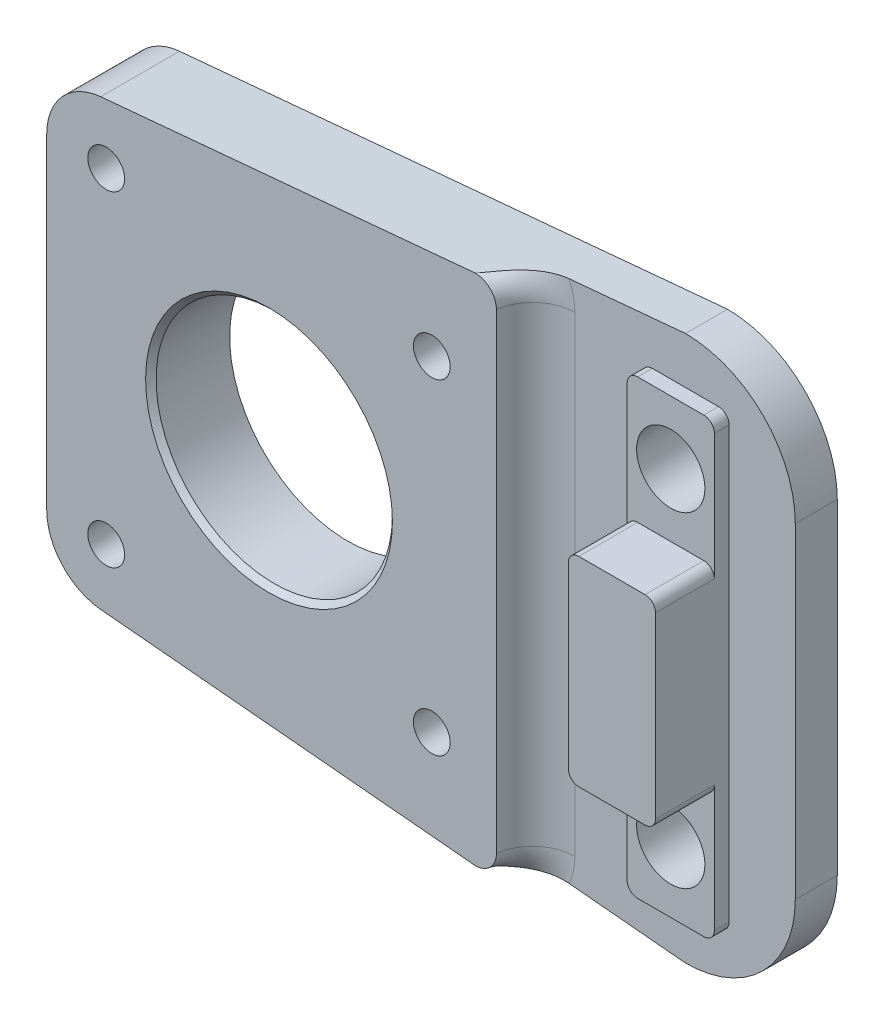
from build123d import *

# Parameters (mm, degrees)
SKETCH_1_R      = 1.7500000000000004
SKETCH_1_R_2    = 1.7499999999999998
SKETCH_1_R_3    = 11.25
SKETCH_1_R_4    = 3.2500000000000004
EXTRUDE_1_DEPTH = 4
SKETCH_1_3_R    = 1.7500000000000004
SKETCH_1_3_R_2  = 1.7499999999999998
SKETCH_1_3_R_3  = 11.25
EXTRUDE_2_DEPTH = 7.5
SKETCH_1_4_W    = 8.299999999999999
SKETCH_1_4_H    = 18.999999999999982
EXTRUDE_3_DEPTH = 11
FILLET_1_R      = 2
FILLET_3_R      = 4
SKETCH_1_5_W    = 8.299999999999999
SKETCH_1_5_H    = 12
SKETCH_1_5_R    = 3.2500000000000004
SKETCH_1_5_H_2  = 11.999999999999996
SKETCH_1_5_H_3  = 18.999999999999982
EXTRUDE_4_DEPTH = 5.4
FILLET_2_R      = 1
CHAMFER_1_SIZE  = 0.5


with BuildPart() as part:
    # Эскиз1 → Бобышка-Вытянуть1 (new body)
    with BuildSketch(Plane.XY):
        with BuildLine():
            ThreePointArc((-32.16450146827534, 21.221984437073093), (-35.82965440560809, 19.39826009426678), (-37.30887383412098, 15.581032511990193))
            Line((-37.30887383412098, 15.581032511990193), (-37.30887383412098, -15.418967488009775))
            ThreePointArc((-37.30887383412098, -15.418967488009775), (-35.829654405608096, -19.23619507028637), (-32.16450146827534, -21.059919413092672))
            Line((-32.16450146827534, -21.059919413092672), (20.006045179765074, -25.87421379899061))
            ThreePointArc((20.006045179765074, -25.87421379899061), (27.399020745235244, -22.811943053479965), (30.46129149074589, -15.41896748800979))
            Line((30.46129149074589, -15.418967488009791), (30.461291490745886, 15.581032511990195))
            ThreePointArc((30.461291490745886, 15.581032511990195), (27.39902074523524, 22.97400807746036), (20.006045179765074, 26.036278822971013))
            Line((20.006045179765074, 26.036278822971013), (-32.16450146827534, 21.221984437073093))
        make_face()
        with Locations((-31.643954820235436, -15.418967488009791)):
            Circle(SKETCH_1_R, mode=Mode.SUBTRACT)
        with Locations((-0.643954820235465, -15.418967488009791)):
            Circle(SKETCH_1_R_2, mode=Mode.SUBTRACT)
        with Locations((-16.14395482023548, 0.08103251199020889)):
            Circle(SKETCH_1_R_3, mode=Mode.SUBTRACT)
        with Locations((-31.643954820235436, 15.581032511990195)):
            Circle(SKETCH_1_R, mode=Mode.SUBTRACT)
        with Locations((-0.643954820235465, 15.581032511990195)):
            Circle(SKETCH_1_R, mode=Mode.SUBTRACT)
        with Locations((20.006045179765074, -15.418967488009791)):
            Circle(SKETCH_1_R_4, mode=Mode.SUBTRACT)
        with Locations((20.00604517976507, 15.581032511990195)):
            Circle(SKETCH_1_R_4, mode=Mode.SUBTRACT)
    extrude(amount=EXTRUDE_1_DEPTH)

    # Эскиз1<3> → Бобышка-Вытянуть2 (add)
    with BuildSketch(Plane.XY):
        with BuildLine():
            ThreePointArc((-32.16450146827534, 21.221984437073093), (-35.82965440560809, 19.39826009426678), (-37.30887383412098, 15.581032511990193))
            Line((-37.30887383412098, 15.581032511990193), (-37.30887383412098, -15.418967488009775))
            ThreePointArc((-37.30887383412098, -15.418967488009775), (-35.829654405608096, -19.23619507028637), (-32.16450146827534, -21.059919413092672))
            Line((-32.16450146827533, -21.059919413092675), (5.506045179765067, -24.536154815893063))
            Line((5.506045179765067, -24.536154815893056), (5.506045179765067, 24.698219839873474))
            Line((5.506045179765069, 24.698219839873467), (-32.16450146827534, 21.221984437073093))
        make_face()
        with Locations((-31.643954820235436, -15.418967488009791)):
            Circle(SKETCH_1_3_R, mode=Mode.SUBTRACT)
        with Locations((-0.643954820235465, -15.418967488009791)):
            Circle(SKETCH_1_3_R_2, mode=Mode.SUBTRACT)
        with Locations((-16.14395482023548, 0.08103251199020889)):
            Circle(SKETCH_1_3_R_3, mode=Mode.SUBTRACT)
        with Locations((-31.643954820235436, 15.581032511990195)):
            Circle(SKETCH_1_3_R, mode=Mode.SUBTRACT)
        with Locations((-0.643954820235465, 15.581032511990195)):
            Circle(SKETCH_1_3_R, mode=Mode.SUBTRACT)
    extrude(amount=EXTRUDE_2_DEPTH)

    # Эскиз1<4> → Бобышка-Вытянуть3 (add)
    with BuildSketch(Plane.XY):
        with Locations((20.00604517976507, 0.08103251199020356)):
            Rectangle(SKETCH_1_4_W, SKETCH_1_4_H)
    extrude(amount=EXTRUDE_3_DEPTH)

    # Скругление1
    fillet_1_edges = [part.edges().sort_by_distance(p)[0] for p in [
        (5.506045179765067, -24.53615481589306, 5.75),
        (5.506045179765068, 24.69821983987347, 5.75),
    ]]
    fillet(fillet_1_edges, radius=FILLET_1_R)

    # Скругление3
    # the kernel refuses this fillet: 4 mm, written as the material it adds along each edge
    with BuildSketch(Plane(origin=(3.506045179765067, 22.505162446697916, 4), x_dir=(0.9999802608561372, -0.006283143965559292, 0), z_dir=(0.006283143965559292, 0.9999802608561372, 0))) as fillet_3_piece_1_section:
        with BuildLine():
            CenterArc((5.968626966596891, -4.000000000000001), FILLET_3_R, 90, 82.81924421854171)
            Line((5.968626966596891, 0), (1.9999999999999991, 0))
            Line((1.9999999999999991, 0), (2.0000000000000044, -3.5000000000000018))
        make_face()
    fillet_3_piece_1 = revolve(axis=Axis((3.506045179765067, 22.505162446697916, 4), (0, 0, -1)), revolution_arc=359.64, mode=Mode.PRIVATE)
    fillet_3_piece_1 = split(fillet_3_piece_1, bisect_by=Plane(origin=(3.3222661542347938, 24.49670086454859, 4), z_dir=(0.09188951276513632, -0.9957692089253342, 0)), keep=Keep.TOP, mode=Mode.PRIVATE)
    add(fillet_3_piece_1)
    with BuildSketch(Plane(origin=(5.506045179765067, 22.505162446697916, 4), x_dir=(1.78e-15, 0, 1), z_dir=(0, -1, 0))) as fillet_3_piece_2:
        with BuildLine():
            CenterArc((4.000000000000007, -3.9686269665968847), FILLET_3_R, 97.18075578145837, 82.81924421854171)
            Line((7.05e-15, -3.968626966596892), (0, 0))
            Line((0, 0), (3.500000000000001, 0))
        make_face()
    extrude(amount=44.84825986941543)
    with BuildSketch(Plane(origin=(3.506045179765067, -22.343097422717513, 4), x_dir=(1, 0, 0), z_dir=(0, 1, 0))) as fillet_3_piece_3_section:
        with BuildLine():
            CenterArc((5.968626966596892, -4), FILLET_3_R, 90, 82.81924421854171)
            Line((5.968626966596892, 0), (2, 0))
            Line((2, 0), (2.0000000000000044, -3.500000000000001))
        make_face()
    fillet_3_piece_3 = revolve(axis=Axis((3.506045179765067, -22.343097422717513, 4), (0, 0, -1)), revolution_arc=359.64000000000004, mode=Mode.PRIVATE)
    fillet_3_piece_3 = split(fillet_3_piece_3, bisect_by=Plane(origin=(3.322266154234794, -24.33463584056818, 4), z_dir=(0.09188951276513666, 0.9957692089253342, 0)), keep=Keep.TOP, mode=Mode.PRIVATE)
    add(fillet_3_piece_3)

    # Эскиз1<5> → Бобышка-Вытянуть4 (add)
    # profile 1 of 3: a face of its own
    with BuildSketch(Plane.XY):
        with Locations((20.00604517976507, 15.581032511990195)):
            Rectangle(SKETCH_1_5_W, SKETCH_1_5_H)
        with Locations((20.00604517976507, 15.581032511990195)):
            Circle(SKETCH_1_5_R, mode=Mode.SUBTRACT)
    # profile 2 of 3: a face of its own
    with BuildSketch(Plane.XY):
        with Locations((20.00604517976507, -15.418967488009786)):
            Rectangle(SKETCH_1_5_W, SKETCH_1_5_H_2)
        with Locations((20.006045179765074, -15.418967488009791)):
            Circle(SKETCH_1_5_R, mode=Mode.SUBTRACT)
    # profile 3 of 3: a face of its own
    with BuildSketch(Plane.XY):
        with Locations((20.00604517976507, 0.08103251199020356)):
            Rectangle(SKETCH_1_5_W, SKETCH_1_5_H_3)
    extrude(amount=EXTRUDE_4_DEPTH)

    # Скругление2
    fillet_2_edges = [part.edges().sort_by_distance(p)[0] for p in [
        (15.85604517976507, 21.581032511990195, 4.7),
        (24.15604517976507, -21.418967488009784, 4.7),
        (15.85604517976507, -21.418967488009784, 4.7),
        (24.15604517976507, 21.581032511990195, 4.7),
        (15.85604517976507, -9.418967488009788, 8.2),
        (24.15604517976507, -9.418967488009788, 8.2),
        (24.15604517976507, 9.581032511990195, 8.2),
        (15.85604517976507, 9.581032511990195, 8.2),
    ]]
    fillet(fillet_2_edges, radius=FILLET_2_R)

    # Фаска1
    chamfer_1_edges = [part.edges().sort_by_distance(p)[0] for p in [
        (-27.39395482023548, 0.08103251199021026, 7.5),
    ]]
    chamfer(chamfer_1_edges, length=CHAMFER_1_SIZE)


solid = part.part
